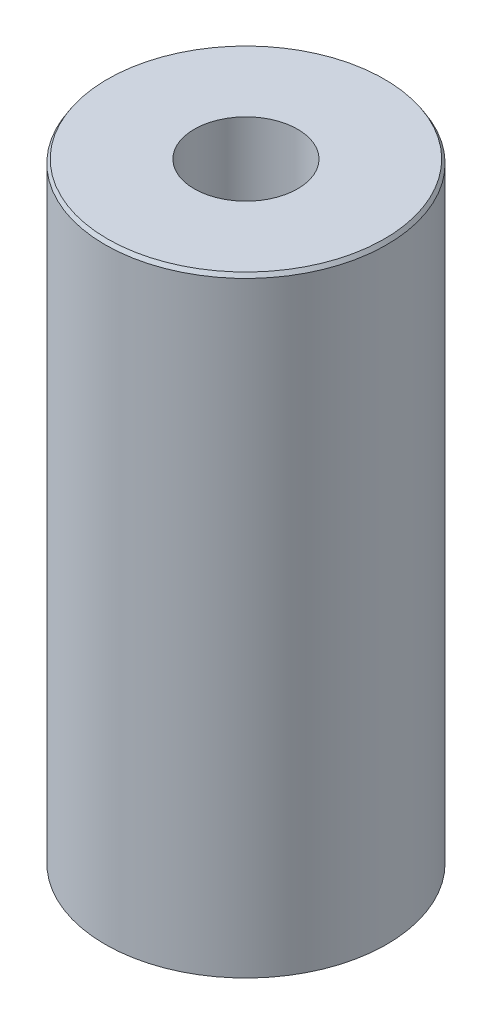
from build123d import *
from OCP.BRepFilletAPI import BRepFilletAPI_MakeChamfer

# Parameters (mm, degrees)
SKETCH1_R           = 37.5
BOSS_EXTRUDE1_DEPTH = 162.994726828
SKETCH2_R           = 13.765047701
CUT_EXTRUDE1_DEPTH  = 172.405311977
CHAMFER1_SIZE       = 1.021779872
CHAMFER1_SIZE2      = 0.639324679


with BuildPart() as part:
    # Sketch1 → Boss-Extrude1 (new body)
    with BuildSketch(Plane(origin=(0, 0, 0), x_dir=(1, 0, 0), z_dir=(0, 1, 0))):
        Circle(SKETCH1_R)
    extrude(amount=BOSS_EXTRUDE1_DEPTH)

    # Sketch2 → Cut-Extrude1 (cut, through all)
    with BuildSketch(Plane(origin=(0, 0, 0), x_dir=(1, 0, 0), z_dir=(0, 1, 0))):
        Circle(SKETCH2_R)
    extrude(amount=CUT_EXTRUDE1_DEPTH, mode=Mode.SUBTRACT)

    # Chamfer1: one chamfer whose edges measure the first distance from different faces: ONE call of the kernel's chamfer builder (chamfer() names one face for all edges)
    chamfer1_edges_1 = [part.edges().sort_by_distance(p)[0] for p in [
        (-37.5, 162.994726828, 0),
    ]]
    chamfer1_side_1 = [part.faces().sort_by_distance(p)[0] for p in [
        (-37.5, 81.497363414, 0),
    ]]
    chamfer1_edges_2 = [part.edges().sort_by_distance(p)[0] for p in [
        (-37.5, 0, 0),
    ]]
    chamfer1_side_2 = [part.faces().sort_by_distance(p)[0] for p in [
        (-36.439339828, 0, 0),
    ]]
    chamfer1 = BRepFilletAPI_MakeChamfer(part.part.solid().wrapped)
    for e in chamfer1_edges_1:
        chamfer1.Add(CHAMFER1_SIZE, CHAMFER1_SIZE2, e.wrapped, chamfer1_side_1[0].wrapped)  # the first distance lies on this face
    for e in chamfer1_edges_2:
        chamfer1.Add(CHAMFER1_SIZE, CHAMFER1_SIZE2, e.wrapped, chamfer1_side_2[0].wrapped)  # the first distance lies on this face
    add(Compound.cast(chamfer1.Shape()), mode=Mode.REPLACE)


solid = part.part
